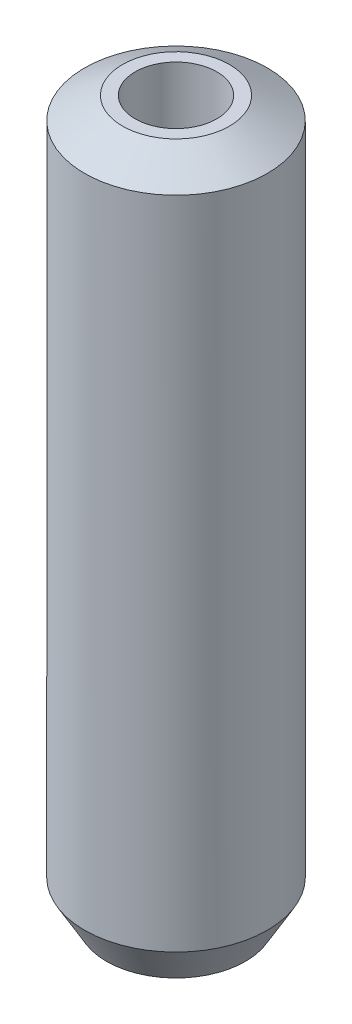
from build123d import *
from OCP.BRepFilletAPI import BRepFilletAPI_MakeChamfer

# Parameters (mm, degrees)
SKETCH1_R           = 15
BOSS_EXTRUDE1_DEPTH = 117.374975051
SKETCH2_R           = 6.695564317
CUT_EXTRUDE1_DEPTH  = 120.276505517
CHAMFER1_SIZE       = 3.596435642
CHAMFER1_SIZE2      = 6.229209257


with BuildPart() as part:
    # Sketch1 → Boss-Extrude1 (new body)
    with BuildSketch(Plane(origin=(0, 0, 0), x_dir=(1, 0, 0), z_dir=(0, 1, 0))):
        Circle(SKETCH1_R)
    extrude(amount=BOSS_EXTRUDE1_DEPTH)

    # Sketch2 → Cut-Extrude1 (cut, through all)
    with BuildSketch(Plane(origin=(0, 0, 0), x_dir=(1, 0, 0), z_dir=(0, 1, 0))):
        Circle(SKETCH2_R)
    extrude(amount=CUT_EXTRUDE1_DEPTH, mode=Mode.SUBTRACT)

    # Chamfer1: one chamfer whose edges measure the first distance from different faces: ONE call of the kernel's chamfer builder (chamfer() names one face for all edges)
    chamfer1_edges_1 = [part.edges().sort_by_distance(p)[0] for p in [
        (-15, 117.374975051, 0),
    ]]
    chamfer1_side_1 = [part.faces().sort_by_distance(p)[0] for p in [
        (-15, 58.687487526, 0),
    ]]
    chamfer1_edges_2 = [part.edges().sort_by_distance(p)[0] for p in [
        (-15, 0, 0),
    ]]
    chamfer1_side_2 = [part.faces().sort_by_distance(p)[0] for p in [
        (-14.575735931, 0, 0),
    ]]
    chamfer1 = BRepFilletAPI_MakeChamfer(part.part.solid().wrapped)
    for e in chamfer1_edges_1:
        chamfer1.Add(CHAMFER1_SIZE, CHAMFER1_SIZE2, e.wrapped, chamfer1_side_1[0].wrapped)  # the first distance lies on this face
    for e in chamfer1_edges_2:
        chamfer1.Add(CHAMFER1_SIZE, CHAMFER1_SIZE2, e.wrapped, chamfer1_side_2[0].wrapped)  # the first distance lies on this face
    add(Compound.cast(chamfer1.Shape()), mode=Mode.REPLACE)


solid = part.part
